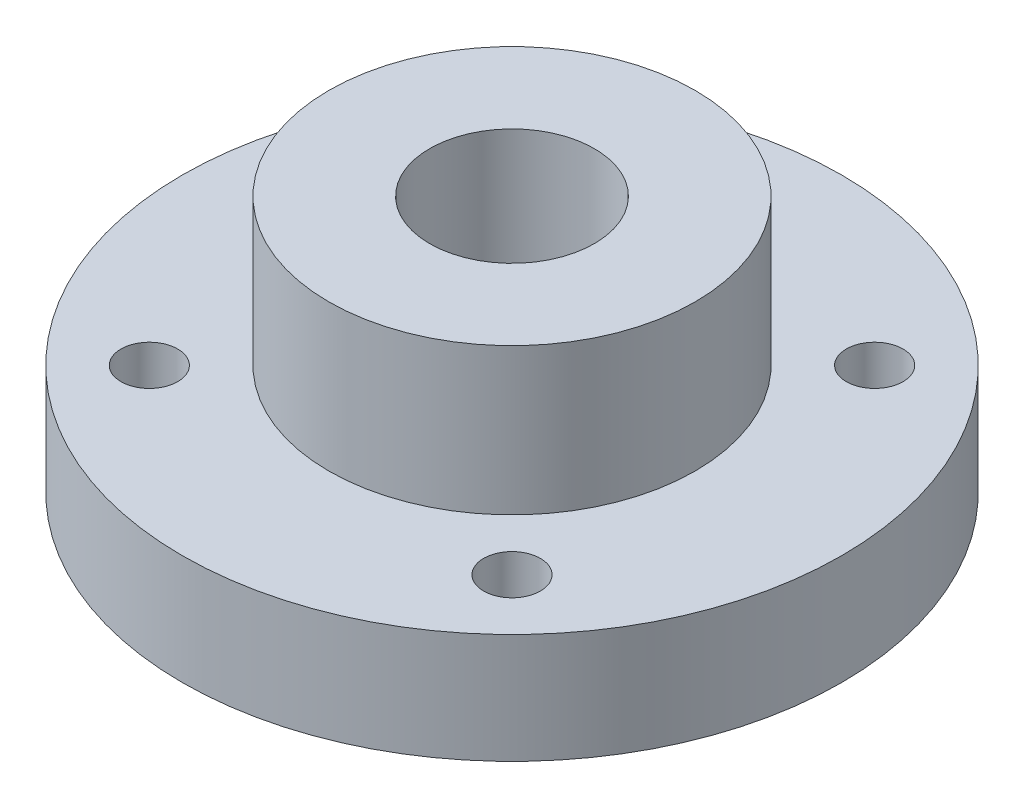
from build123d import *

# Parameters (mm, degrees)
F_10_0_1935_DIAMETER_HOLE1_D      = 4.9149
PIPE_TAP_DRILL_FOR_3_8_TAP1_D     = 14.2748
PIPE_TAP_DRILL_FOR_3_8_TAP1_DEPTH = 14.2875
PIPE_TAP_DRILL_FOR_3_8_TAP1_TIP   = 4.288582582


with BuildPart() as part:
    # Sketch1 → Revolve1 (revolve)
    with BuildSketch(Plane.XY):
        Polygon((-11.1125, -70.655212574), (-11.1125, -77.005212574), (-14.1605, -77.005212574), (-14.1605, -73.830212574), (-14.1605, -70.693312574), (-19.05, -70.693312574), (-19.05, -73.830212574), (-28.575, -73.830212574), (-28.575, -64.305212574), (-15.875, -64.305212574), (-15.875, -51.605212574), (-4.7625, -51.605212574), (-4.7625, -70.655212574), align=None)
    revolve(axis=Axis((0, 0, 0), (0, -1, 0)))

    # #10 (0.1935) Diameter Hole1 (through all)
    with Locations(Plane(origin=(0, -51.605212574, 0), x_dir=(1, 0, 0), z_dir=(0, 1, 0))):
        with Locations((15.715448212, 15.715448212), (-15.715448212, 15.715448212), (-15.715448212, -15.715448212), (15.715448212, -15.715448212)):
            Hole(F_10_0_1935_DIAMETER_HOLE1_D / 2)

    # Pipe Tap Drill for 3/8 Tap1
    with Locations(Plane.ZX.offset(-51.605212574)):
        with Locations((0, 0)):
            Hole(PIPE_TAP_DRILL_FOR_3_8_TAP1_D / 2, depth=PIPE_TAP_DRILL_FOR_3_8_TAP1_DEPTH)
            with Locations((0, 0, -(PIPE_TAP_DRILL_FOR_3_8_TAP1_DEPTH + PIPE_TAP_DRILL_FOR_3_8_TAP1_TIP / 2))):  # 118° drill point
                Cone(0, PIPE_TAP_DRILL_FOR_3_8_TAP1_D / 2, PIPE_TAP_DRILL_FOR_3_8_TAP1_TIP, mode=Mode.SUBTRACT)


solid = part.part
